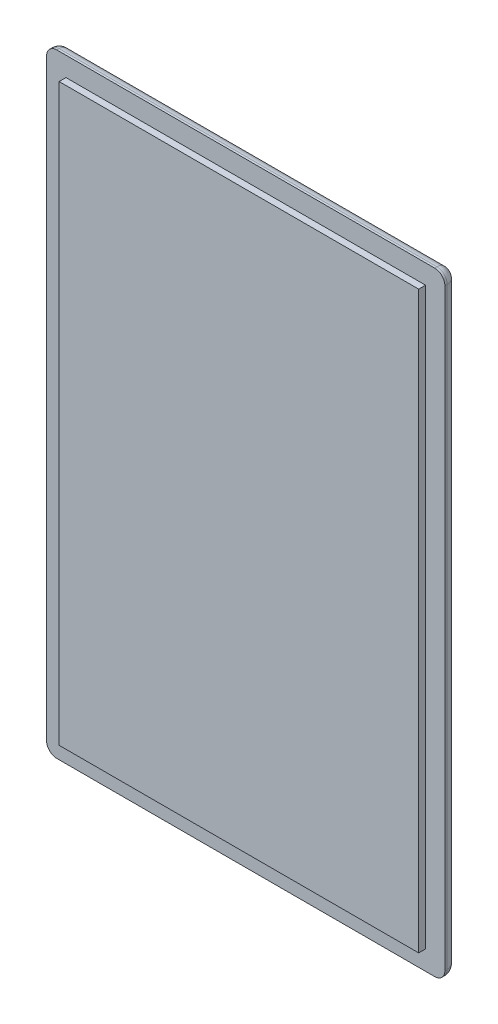
from build123d import *

# Parameters (mm, degrees)
SKETCH1_W           = 370
SKETCH1_H           = 570
BOSS_EXTRUDE1_DEPTH = 18
SKETCH2_W           = 370
SKETCH2_H           = 570
SKETCH2_W_2         = 334
SKETCH2_H_2         = 534
CUT_EXTRUDE1_DEPTH  = 6.35
FILLET1_R           = 9.525


with BuildPart() as part:
    # Sketch1 → Boss-Extrude1 (new body)
    with BuildSketch(Plane.XY):
        with Locations((185, 285)):
            Rectangle(SKETCH1_W, SKETCH1_H)
    extrude(amount=BOSS_EXTRUDE1_DEPTH)

    # Sketch2 → Cut-Extrude1 (cut)
    with BuildSketch(Plane.XY.offset(18)):
        with Locations((185, 285)):
            Rectangle(SKETCH2_W, SKETCH2_H)
        with Locations((185, 285)):
            Rectangle(SKETCH2_W_2, SKETCH2_H_2, mode=Mode.SUBTRACT)
    extrude(amount=-CUT_EXTRUDE1_DEPTH, mode=Mode.SUBTRACT)

    # Fillet1
    fillet1_edges = [part.edges().sort_by_distance(p)[0] for p in [
        (0, 570, 5.825),
        (185, 570, 0),
        (370, 570, 5.825),
        (370, 285, 0),
        (0, 285, 0),
        (185, 0, 0),
        (0, 0, 5.825),
        (370, 0, 5.825),
    ]]
    fillet(fillet1_edges, radius=FILLET1_R)


solid = part.part
